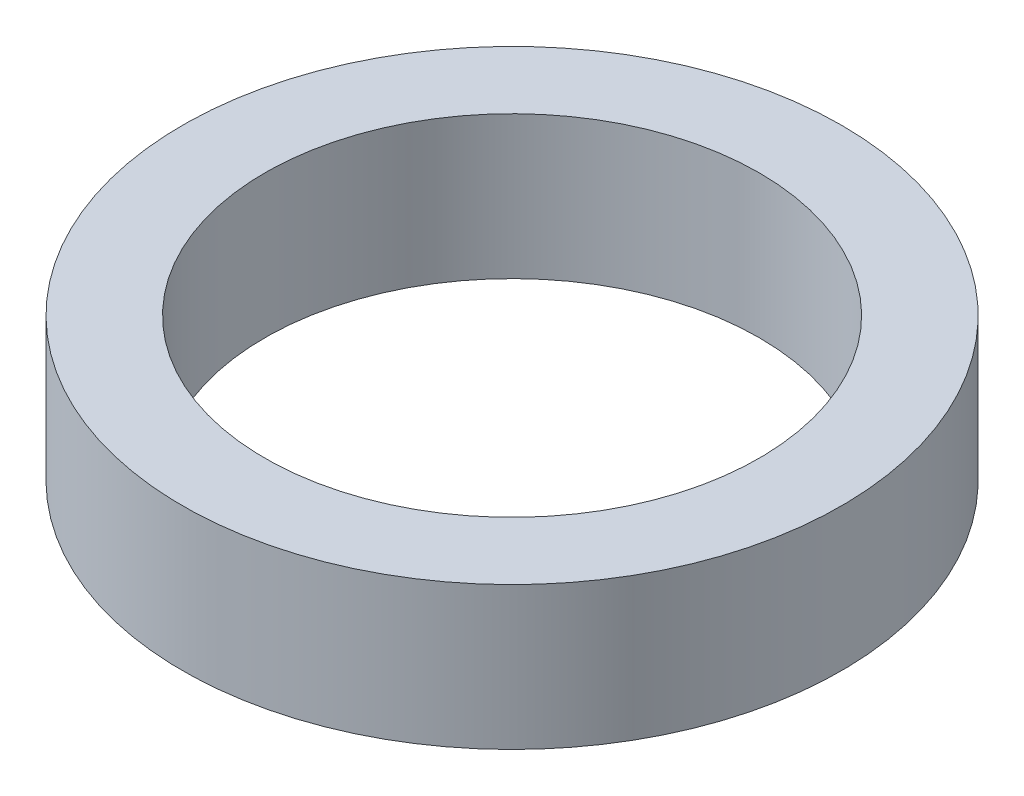
from build123d import *

# Parameters (mm, degrees)
SKETCH1_R           = 30
BOSS_EXTRUDE1_DEPTH = 13
SKETCH2_R           = 22.5
CUT_EXTRUDE1_DEPTH  = 45.373415465


with BuildPart() as part:
    # Sketch1 → Boss-Extrude1 (new body)
    with BuildSketch(Plane(origin=(0, 0, 0), x_dir=(1, 0, 0), z_dir=(0, 1, 0))):
        Circle(SKETCH1_R)
    extrude(amount=BOSS_EXTRUDE1_DEPTH)

    # Sketch2 → Cut-Extrude1 (cut, through all)
    with BuildSketch(Plane(origin=(0, 0, 0), x_dir=(1, 0, 0), z_dir=(0, 1, 0))):
        Circle(SKETCH2_R)
    extrude(amount=CUT_EXTRUDE1_DEPTH, mode=Mode.SUBTRACT)


solid = part.part
